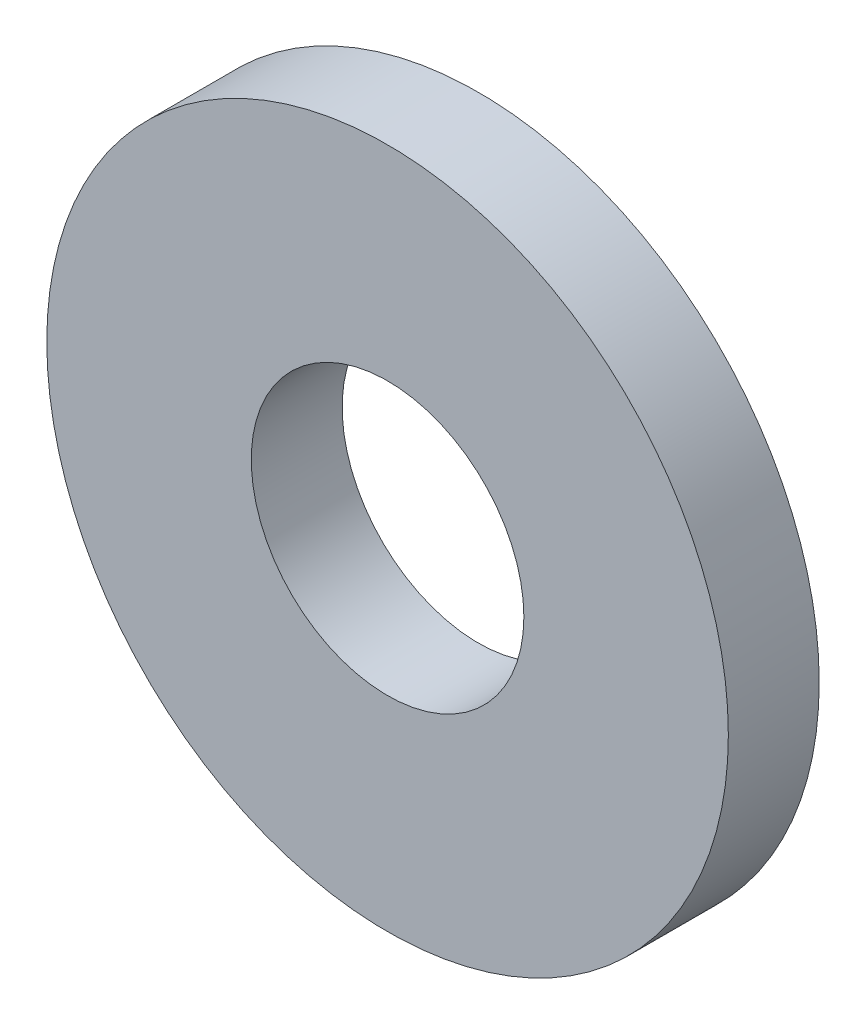
from build123d import *

# Parameters (mm, degrees)
SKETCH_1_R      = 3.75
SKETCH_1_R_2    = 1.5
EXTRUDE_1_DEPTH = 1


with BuildPart() as part:
    # 草图1 → 拉伸1 (new body)
    with BuildSketch(Plane.XY):
        Circle(SKETCH_1_R)
        Circle(SKETCH_1_R_2, mode=Mode.SUBTRACT)
    extrude(amount=EXTRUDE_1_DEPTH)


solid = part.part
